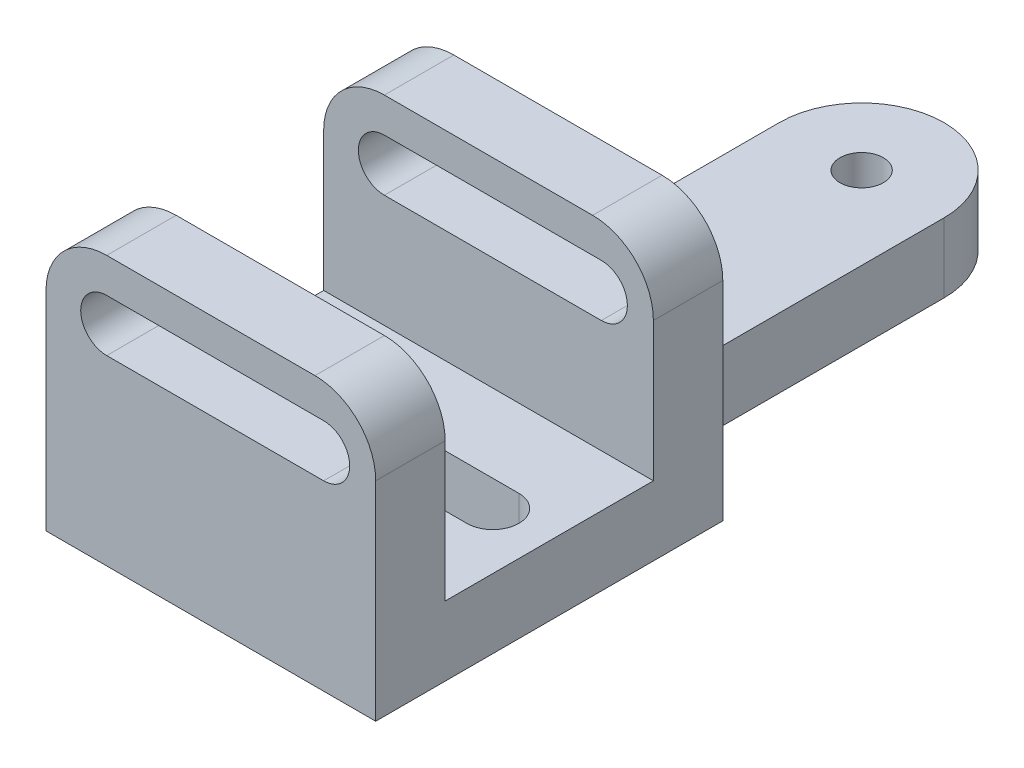
from build123d import *

# Parameters (mm, degrees)
ESTRUSIONE_ESTRUSIONE1_DEPTH = 38
SCHIZZO3_W                   = 38
SCHIZZO3_H                   = 89
ESTRUSIONE_ESTRUSIONE2_DEPTH = 16
RACCORDO1_R                  = 19
RACCORDO2_R                  = 14
TAGLIO_ESTRUSIONE1_REACH     = 181.223
TAGLIO_ESTRUSIONE2_DEPTH     = 184.980977278
FORO_10_0_10_2_D             = 10
RACCORDO3_R                  = 14


with BuildPart() as part:
    # Schizzo2 → Estrusione-Estrusione1 (new, symmetric)
    with BuildSketch(Plane(origin=(0, 0, 0), x_dir=(0, 0, -1), z_dir=(1, 0, 0))):
        Polygon((0, 62), (0, 0), (80, 0), (80, 62), (64, 62), (64, 16), (16, 16), (16, 62), align=None)
    extrude(amount=ESTRUSIONE_ESTRUSIONE1_DEPTH, both=True)

    # Schizzo3 → Estrusione-Estrusione2 (add)
    with BuildSketch(Plane.XZ):
        with Locations((0, -124.5)):
            Rectangle(SCHIZZO3_W, SCHIZZO3_H)
    extrude(amount=-ESTRUSIONE_ESTRUSIONE2_DEPTH)

    # Raccordo1
    raccordo1_edges = [part.edges().sort_by_distance(p)[0] for p in [
        (19, 8, -169),
        (-19, 8, -169),
    ]]
    fillet(raccordo1_edges, radius=RACCORDO1_R - 0.0001)  # a hair under: the kernel refuses the full size

    # Raccordo2
    raccordo2_edges = [part.edges().sort_by_distance(p)[0] for p in [
        (-38, 62, -8),
        (38, 62, -72),
        (38, 62, -8),
        (-38, 62, -72),
    ]]
    fillet(raccordo2_edges, radius=RACCORDO2_R)

    # Schizzo4 → Taglio-Estrusione1 (cut, up to next)
    with BuildSketch(Plane(origin=(0, 16, 0), x_dir=(1, 0, 0), z_dir=(0, 1, 0)), mode=Mode.PRIVATE) as taglio_estrusione1_sk1:
        with BuildLine():
            Line((25, 34), (-25, 34))
            ThreePointArc((-25, 34), (-31, 40), (-25, 46))
            Line((-25, 46), (25, 46))
            ThreePointArc((25, 46), (31, 40), (25, 34))
        make_face()
    taglio_estrusione1_tool1 = extrude(taglio_estrusione1_sk1.sketch, amount=-TAGLIO_ESTRUSIONE1_REACH, mode=Mode.PRIVATE) & part.part
    add(taglio_estrusione1_tool1.solids().sort_by_distance((0, 16, -40))[0], mode=Mode.SUBTRACT)

    # Schizzo5 → Taglio-Estrusione2 (cut, through all)
    with BuildSketch(Plane.XY):
        with BuildLine():
            Line((-24, 54), (26, 54))
            ThreePointArc((26, 54), (32, 48), (26, 42))
            Line((26, 42), (-24, 42))
            ThreePointArc((-24, 42), (-30, 48), (-24, 54))
        make_face()
    extrude(amount=-TAGLIO_ESTRUSIONE2_DEPTH, mode=Mode.SUBTRACT)

    # Foro Ø10.0 (10)-2 (through all)
    with Locations(Plane(origin=(0, 16, 0), x_dir=(1, 0, 0), z_dir=(0, 1, 0))):
        with Locations((0, 150)):
            Hole(FORO_10_0_10_2_D / 2)

    # Raccordo3
    raccordo3_edges = [part.edges().sort_by_distance(p)[0] for p in [
        (-19, 8, -80),
        (19, 8, -80),
    ]]
    fillet(raccordo3_edges, radius=RACCORDO3_R)


solid = part.part
